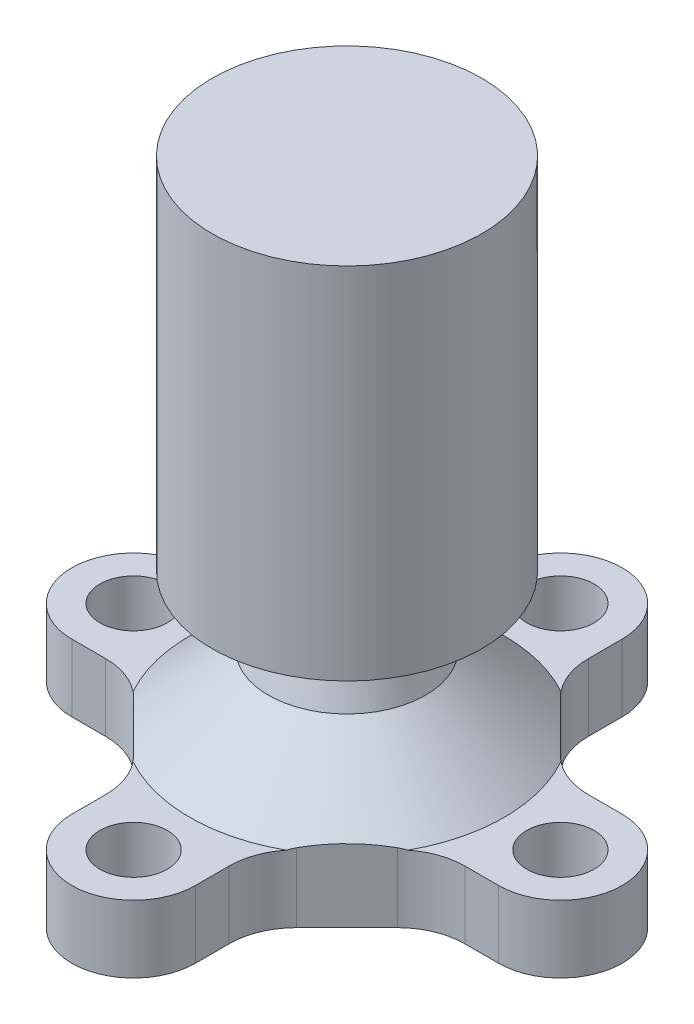
from build123d import *

# Parameters (mm, degrees)
SKETCH2_R          = 1.5
CUT_EXTRUDE1_DEPTH = 5
SKETCH3_R          = 13
CUT_EXTRUDE2_DEPTH = 5
FILLET1_R          = 3


with BuildPart() as part:
    # Sketch1 → Revolve2 (revolve)
    with BuildSketch(Plane.XY):
        Polygon((-6, 25), (-6, 9), (-2.5, 9), (-3.5, 5.960263169), (-7, 3), (-13, 3), (-13, 0), (0, 0), (0, 25), align=None)
    revolve(axis=Axis((0, 0, 0), (0, 1, 0)))

    # Sketch2 → Cut-Extrude1 (cut)
    with BuildSketch(Plane.XZ):
        with Locations((0, 9.5)):
            Circle(SKETCH2_R)
        with Locations((9.5, 0)):
            Circle(SKETCH2_R)
        with Locations((0, -9.5)):
            Circle(SKETCH2_R)
        with Locations((-9.5, 0)):
            Circle(SKETCH2_R)
    extrude(amount=-CUT_EXTRUDE1_DEPTH, mode=Mode.SUBTRACT)

    # Sketch3 → Cut-Extrude2 (cut)
    with BuildSketch(Plane.XZ):
        Circle(SKETCH3_R)
        with BuildLine():
            ThreePointArc((-9.5, -2.75), (-12.25, 0), (-9.5, 2.75))
            Line((-9.5, 2.75), (-6.75, 2.75))
            Line((-6.75, 2.75), (-2.75, 6.75))
            Line((-2.75, 6.75), (-2.75, 9.5))
            ThreePointArc((-2.75, 9.5), (0, 12.25), (2.75, 9.5))
            Line((2.75, 9.5), (2.75, 6.75))
            Line((2.75, 6.75), (6.75, 2.75))
            Line((6.75, 2.75), (9.5, 2.75))
            ThreePointArc((9.5, 2.75), (12.25, 0), (9.5, -2.75))
            Line((9.5, -2.75), (6.75, -2.75))
            Line((6.75, -2.75), (2.75, -6.75))
            Line((2.75, -6.75), (2.75, -9.5))
            ThreePointArc((2.75, -9.5), (0, -12.25), (-2.75, -9.5))
            Line((-2.75, -9.5), (-2.75, -6.75))
            Line((-2.75, -6.75), (-6.75, -2.75))
            Line((-6.75, -2.75), (-9.5, -2.75))
        make_face(mode=Mode.SUBTRACT)
    extrude(amount=-CUT_EXTRUDE2_DEPTH, mode=Mode.SUBTRACT)

    # Fillet1
    fillet1_edges = [part.edges().sort_by_distance(p)[0] for p in [
        (-2.75, 1.5, 6.75),
    ]]
    fillet(fillet1_edges, radius=FILLET1_R)
    fillet1_2_edges = [part.edges().sort_by_distance(p)[0] for p in [
        (-6.75, 1.5, 2.75),
    ]]
    fillet(fillet1_2_edges, radius=FILLET1_R)
    fillet1_3_edges = [part.edges().sort_by_distance(p)[0] for p in [
        (6.75, 1.5, 2.75),
    ]]
    fillet(fillet1_3_edges, radius=FILLET1_R)
    fillet1_4_edges = [part.edges().sort_by_distance(p)[0] for p in [
        (2.75, 1.5, 6.75),
    ]]
    fillet(fillet1_4_edges, radius=FILLET1_R)
    fillet1_5_edges = [part.edges().sort_by_distance(p)[0] for p in [
        (2.75, 1.5, -6.75),
    ]]
    fillet(fillet1_5_edges, radius=FILLET1_R)
    fillet1_6_edges = [part.edges().sort_by_distance(p)[0] for p in [
        (6.75, 1.5, -2.75),
    ]]
    fillet(fillet1_6_edges, radius=FILLET1_R)
    fillet1_7_edges = [part.edges().sort_by_distance(p)[0] for p in [
        (-6.75, 1.5, -2.75),
    ]]
    fillet(fillet1_7_edges, radius=FILLET1_R)
    fillet1_8_edges = [part.edges().sort_by_distance(p)[0] for p in [
        (-2.75, 1.5, -6.75),
    ]]
    fillet(fillet1_8_edges, radius=FILLET1_R)


solid = part.part
